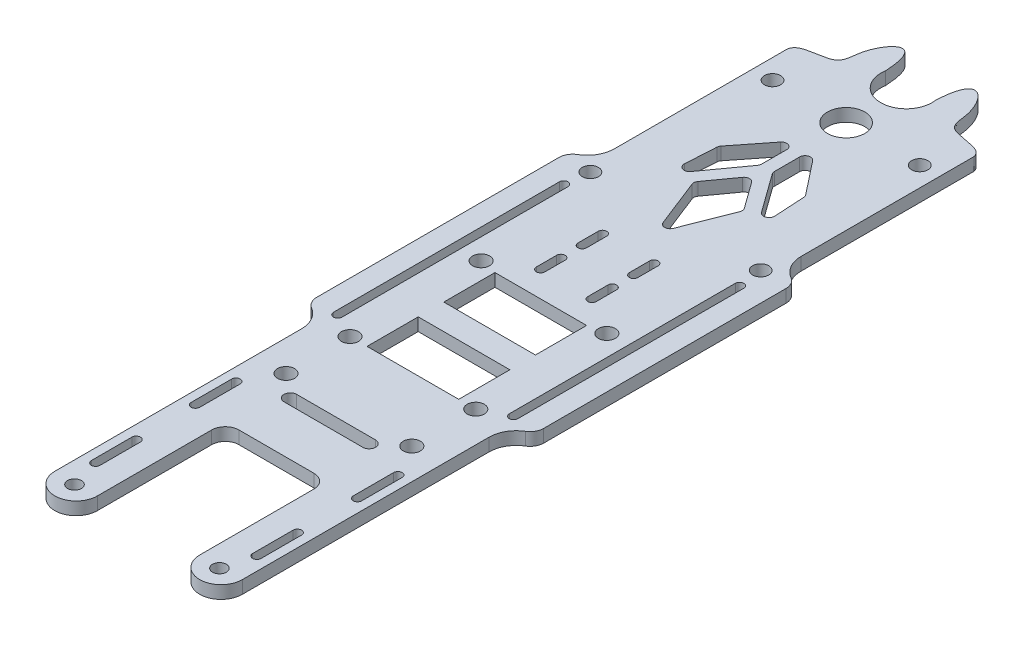
from build123d import *

# Parameters (mm, degrees)
BOSS_EXTRUDE2_START       = -1.190625
BOSS_EXTRUDE2_OUTLINE_R   = 1.28984375
BOSS_EXTRUDE2_OUTLINE_R_2 = 1.5875
BOSS_EXTRUDE2_OUTLINE_W   = 17.065625
BOSS_EXTRUDE2_OUTLINE_H   = 9.525
BOSS_EXTRUDE2_OUTLINE_R_3 = 1.503965808
BOSS_EXTRUDE2_OUTLINE_R_4 = 3.47265625
BOSS_EXTRUDE2_DEPTH       = 2.38125
FILLET1_R                 = 5.08
FILLET2_R                 = 2.54
FILLET5_R                 = 1.016
FILLET12_RADIUS           = 3.96875
FILLET12_LENGTH           = 2.38125
FILLET13_RADIUS           = 3.96875
FILLET13_LENGTH           = 2.38125


# Read off the part's stored shape, not the designer's step: Boss-Extrude2
with BuildPart() as part:
    # Boss-Extrude2 outline → Boss-Extrude2 (new body)
    with BuildSketch(Plane(origin=(0, 0, 0), x_dir=(1, 0, 0), z_dir=(0, 1, 0)).offset(BOSS_EXTRUDE2_START)):
        with BuildLine():
            add(Edge.make_bspline(
                [(35.342657076, 85.942887732), (35.813923692, 94.740411175), (40.962574381, 89.316823015), (40.695244857, 81.321998033), (47.518785772, 82.755289855), (48.014774244, 80.35917777)],
                knots=[0, 0, 0, 0, 0.509251893, 0.660798718, 1, 1, 1, 1], degree=3))
            ThreePointArc((35.342657076, 85.942887732), (30.651492993, 80.35917777), (25.960328911, 85.942887732))
            add(Edge.make_bspline(
                [(25.960328911, 85.942887732), (25.489062296, 94.740411175), (20.340411606, 89.316823015), (20.607741131, 81.321998033), (13.784200215, 82.755289855), (13.288211744, 80.35917777)],
                knots=[0, 0, 0, 0, 0.509251893, 0.660798718, 1, 1, 1, 1], degree=3))
            Line((13.288211744, 80.35917777), (13.288211744, 43.25136527))
            Line((13.288211744, 43.25136527), (9.517899244, 43.25136527))
            Line((9.517899244, 43.25136527), (9.517899244, -5.16738473))
            Line((9.517899244, -5.16738473), (13.188992994, -5.16738473))
            Line((13.188992994, -5.16738473), (13.188992994, -59.93613473))
            Line((13.188992994, -59.93613473), (21.126492994, -59.93613473))
            Line((21.126492994, -59.93613473), (21.126492994, -32.15488473))
            Line((21.126492994, -32.15488473), (40.176492994, -32.15488473))
            Line((40.176492994, -32.15488473), (40.176492994, -59.93613473))
            Line((40.176492994, -59.93613473), (48.113992994, -59.93613473))
            Line((48.113992994, -59.93613473), (48.113992994, -5.16738473))
            Line((48.113992994, -5.16738473), (51.785086744, -5.16738473))
            Line((51.785086744, -5.16738473), (51.785086744, 43.25136527))
            Line((51.785086744, 43.25136527), (48.014774244, 43.25136527))
            Line((48.014774244, 43.25136527), (48.014774244, 80.35917777))
        make_face()
        with Locations((17.157742994, -56.26504098)):
            Circle(BOSS_EXTRUDE2_OUTLINE_R, mode=Mode.SUBTRACT)
        with BuildLine():
            Line((14.854526628, -50.80800973), (14.854526628, -43.26738473))
            ThreePointArc((14.854526628, -43.26738473), (15.648276628, -42.47363473), (16.442026628, -43.26738473))
            Line((16.442026628, -43.26738473), (16.442026628, -50.80800973))
            ThreePointArc((16.442026628, -50.80800973), (15.648276628, -51.60175973), (14.854526628, -50.80800973))
        make_face(mode=Mode.SUBTRACT)
        with BuildLine():
            Line((14.776492994, -32.15488473), (14.776492994, -24.61425973))
            ThreePointArc((14.776492994, -24.61425973), (15.570242994, -23.82050973), (16.363992994, -24.61425973))
            Line((16.363992994, -24.61425973), (16.363992994, -32.15488473))
            ThreePointArc((16.363992994, -32.15488473), (15.570242994, -32.94863473), (14.776492994, -32.15488473))
        make_face(mode=Mode.SUBTRACT)
        with Locations((18.943680494, -18.66113473)):
            Circle(BOSS_EXTRUDE2_OUTLINE_R_2, mode=Mode.SUBTRACT)
        with Locations((18.943680494, -6.75488473)):
            Circle(BOSS_EXTRUDE2_OUTLINE_R_2, mode=Mode.SUBTRACT)
        with BuildLine():
            Line((15.074149244, 37.69511527), (15.074149244, -4.37363473))
            ThreePointArc((15.074149244, -4.37363473), (14.280399244, -5.16738473), (13.486649244, -4.37363473))
            Line((13.486649244, -4.37363473), (13.486649244, 37.69511527))
            ThreePointArc((13.486649244, 37.69511527), (14.280399244, 38.48886527), (15.074149244, 37.69511527))
        make_face(mode=Mode.SUBTRACT)
        with BuildLine():
            Line((23.309305494, -21.04238473), (37.993680494, -21.04238473))
            ThreePointArc((37.993680494, -21.04238473), (39.184305494, -22.23300973), (37.993680494, -23.42363473))
            Line((37.993680494, -23.42363473), (23.309305494, -23.42363473))
            ThreePointArc((23.309305494, -23.42363473), (22.118680494, -22.23300973), (23.309305494, -21.04238473))
        make_face(mode=Mode.SUBTRACT)
        with Locations((44.145242994, -56.26504098)):
            Circle(BOSS_EXTRUDE2_OUTLINE_R, mode=Mode.SUBTRACT)
        with BuildLine():
            Line((44.86095936, -50.80800973), (44.86095936, -43.26738473))
            ThreePointArc((44.86095936, -43.26738473), (45.65470936, -42.47363473), (46.44845936, -43.26738473))
            Line((46.44845936, -43.26738473), (46.44845936, -50.80800973))
            ThreePointArc((46.44845936, -50.80800973), (45.65470936, -51.60175973), (44.86095936, -50.80800973))
        make_face(mode=Mode.SUBTRACT)
        with BuildLine():
            Line((44.938992994, -32.15488473), (44.938992994, -24.61425973))
            ThreePointArc((44.938992994, -24.61425973), (45.732742994, -23.82050973), (46.526492994, -24.61425973))
            Line((46.526492994, -24.61425973), (46.526492994, -32.15488473))
            ThreePointArc((46.526492994, -32.15488473), (45.732742994, -32.94863473), (44.938992994, -32.15488473))
        make_face(mode=Mode.SUBTRACT)
        with Locations((30.651492994, -1.99238473)):
            Rectangle(BOSS_EXTRUDE2_OUTLINE_W, BOSS_EXTRUDE2_OUTLINE_H, mode=Mode.SUBTRACT)
        with Locations((30.651492994, 12.29511527)):
            Rectangle(BOSS_EXTRUDE2_OUTLINE_W, BOSS_EXTRUDE2_OUTLINE_H, mode=Mode.SUBTRACT)
        with Locations((42.359305494, -18.66113473)):
            Circle(BOSS_EXTRUDE2_OUTLINE_R_2, mode=Mode.SUBTRACT)
        with Locations((42.359305494, -6.75488473)):
            Circle(BOSS_EXTRUDE2_OUTLINE_R_2, mode=Mode.SUBTRACT)
        with BuildLine():
            Line((47.816336744, 37.69511527), (47.816336744, -4.37363473))
            ThreePointArc((47.816336744, -4.37363473), (47.022586744, -5.16738473), (46.228836744, -4.37363473))
            Line((46.228836744, -4.37363473), (46.228836744, 37.69511527))
            ThreePointArc((46.228836744, 37.69511527), (47.022586744, 38.48886527), (47.816336744, 37.69511527))
        make_face(mode=Mode.SUBTRACT)
        with Locations((18.943680494, 17.65292777)):
            Circle(BOSS_EXTRUDE2_OUTLINE_R_2, mode=Mode.SUBTRACT)
        with Locations((14.798178171, 42.145625229)):
            Circle(BOSS_EXTRUDE2_OUTLINE_R_3, mode=Mode.SUBTRACT)
        with BuildLine():
            Line((25.074149244, 21.82011527), (25.074149244, 25.590053861))
            ThreePointArc((25.074149244, 25.590053861), (25.867899244, 26.383803861), (26.661649244, 25.590053861))
            Line((26.661649244, 25.590053861), (26.661649244, 21.82011527))
            ThreePointArc((26.661649244, 21.82011527), (25.867899244, 21.02636527), (25.074149244, 21.82011527))
        make_face(mode=Mode.SUBTRACT)
        with BuildLine():
            Line((25.074149244, 29.558803861), (25.074149244, 33.328742451))
            ThreePointArc((25.074149244, 33.328742451), (25.867899244, 34.122492451), (26.661649244, 33.328742451))
            Line((26.661649244, 33.328742451), (26.661649244, 29.558803861))
            ThreePointArc((26.661649244, 29.558803861), (25.867899244, 28.765053861), (25.074149244, 29.558803861))
        make_face(mode=Mode.SUBTRACT)
        Polygon((30.651492994, 38.367133783), (26.006254314, 50.187106609), (30.651492994, 56.623383783), (35.296731673, 50.187106609), align=None, mode=Mode.SUBTRACT)
        with Locations((16.943620936, 73.90995902)):
            Circle(BOSS_EXTRUDE2_OUTLINE_R_3, mode=Mode.SUBTRACT)
        Polygon((22.028486106, 48.744587224), (22.58085534, 58.253557369), (29.460867994, 66.980130702), (29.460867994, 59.042630702), align=None, mode=Mode.SUBTRACT)
        with BuildLine():
            Line((34.641336744, 21.82011527), (34.641336744, 25.590053861))
            ThreePointArc((34.641336744, 25.590053861), (35.435086744, 26.383803861), (36.228836744, 25.590053861))
            Line((36.228836744, 25.590053861), (36.228836744, 21.82011527))
            ThreePointArc((36.228836744, 21.82011527), (35.435086744, 21.02636527), (34.641336744, 21.82011527))
        make_face(mode=Mode.SUBTRACT)
        with BuildLine():
            Line((34.641336744, 29.558803861), (34.641336744, 33.328742451))
            ThreePointArc((34.641336744, 33.328742451), (35.435086744, 34.122492451), (36.228836744, 33.328742451))
            Line((36.228836744, 33.328742451), (36.228836744, 29.558803861))
            ThreePointArc((36.228836744, 29.558803861), (35.435086744, 28.765053861), (34.641336744, 29.558803861))
        make_face(mode=Mode.SUBTRACT)
        with Locations((42.359305494, 17.65292777)):
            Circle(BOSS_EXTRUDE2_OUTLINE_R_2, mode=Mode.SUBTRACT)
        with Locations((46.504807817, 42.145625229)):
            Circle(BOSS_EXTRUDE2_OUTLINE_R_3, mode=Mode.SUBTRACT)
        Polygon((31.842117994, 59.042630702), (31.842117994, 66.980130702), (38.722130648, 58.253557369), (39.274499881, 48.744587224), align=None, mode=Mode.SUBTRACT)
        with Locations((30.651492994, 73.90995902)):
            Circle(BOSS_EXTRUDE2_OUTLINE_R_4, mode=Mode.SUBTRACT)
        with Locations((44.359365051, 73.90995902)):
            Circle(BOSS_EXTRUDE2_OUTLINE_R_3, mode=Mode.SUBTRACT)
    extrude(amount=BOSS_EXTRUDE2_DEPTH)

    # Fillet1
    # the kernel refuses this fillet: 5.08 mm, written as the material it adds along each edge
    with BuildSketch(Plane(origin=(13.288211744, -1.190625, -43.25136527), x_dir=(-1, 0, 0), z_dir=(0, 1, 0))) as fillet1_piece_1:
        with BuildLine():
            CenterArc((5.08, -4.908270434), FILLET1_R, 104.940303131, 75.059696869)
            Line((0, -4.908270434), (0, 0))
            Line((0, 0), (3.7703125, 0))
        make_face()
    fillet1_piece_1_solid = extrude(amount=2.38125, mode=Mode.PRIVATE)
    with BuildSketch(Plane(origin=(48.014774244, -1.190625, -43.25136527), x_dir=(0, 0, -1), z_dir=(0, 1, 0))) as fillet1_piece_2:
        with BuildLine():
            CenterArc((4.908270434, -5.08), FILLET1_R, 90, 75.059696869)
            Line((0, -3.7703125), (0, 0))
            Line((0, 0), (4.908270434, 0))
        make_face()
    fillet1_piece_2_solid = extrude(amount=2.38125, mode=Mode.PRIVATE)
    with BuildSketch(Plane(origin=(48.113992994, -1.190625, 5.16738473), x_dir=(1, 0, 0), z_dir=(0, 1, 0))) as fillet1_piece_3:
        with BuildLine():
            CenterArc((5.08, -4.880715437), FILLET1_R, 106.101735181, 73.898264819)
            Line((0, -4.880715437), (0, 0))
            Line((0, 0), (3.67109375, 0))
        make_face()
    fillet1_piece_3_solid = extrude(amount=2.38125, mode=Mode.PRIVATE)
    with BuildSketch(Plane(origin=(13.188992994, -1.190625, 5.16738473), x_dir=(0, 0, 1), z_dir=(0, 1, 0))) as fillet1_piece_4:
        with BuildLine():
            CenterArc((4.880715437, -5.08), FILLET1_R, 90, 73.898264819)
            Line((0, -3.67109375), (0, 0))
            Line((0, 0), (4.880715437, 0))
        make_face()
    fillet1_piece_4_solid = extrude(amount=2.38125, mode=Mode.PRIVATE)
    add([fillet1_piece_1_solid, fillet1_piece_2_solid, fillet1_piece_3_solid, fillet1_piece_4_solid])

    # Fillet2
    fillet2_edges = [part.edges().sort_by_distance(p)[0] for p in [
        (51.785086744, 0, -43.25136527),
        (51.785086744, 0, 5.16738473),
        (40.176492994, 0, 32.15488473),
        (21.126492994, 0, 32.15488473),
        (9.517899244, 0, 5.16738473),
        (9.517899244, 0, -43.25136527),
    ]]
    fillet(fillet2_edges, radius=FILLET2_R)

    # Fillet5
    fillet5_edges = [part.edges().sort_by_distance(p)[0] for p in [
        (31.842117994, 0, -66.980130702),
        (31.842117994, 0, -59.042630702),
        (39.274499881, 0, -48.744587224),
        (38.722130648, 0, -58.253557369),
        (22.028486106, 0, -48.744587224),
        (29.460867994, 0, -59.042630702),
        (29.460867994, 0, -66.980130702),
        (22.58085534, 0, -58.253557369),
        (26.006254314, 0, -50.187106609),
        (30.651492994, 0, -38.367133783),
        (35.296731673, 0, -50.187106609),
        (30.651492994, 0, -56.623383783),
    ]]
    fillet(fillet5_edges, radius=FILLET5_R)

    # Fillet12: full round fillet: the end face becomes a half cylinder, R = half its width
    fillet12_face = Plane((17.157742994, 0, 59.93613473), x_dir=(0, 1, 0), z_dir=(0, 0, 1))  # on the end face: x along it, z out of the body
    fillet12_slab = fillet12_face.offset(-FILLET12_RADIUS / 2) * Box(FILLET12_LENGTH, 2 * FILLET12_RADIUS, FILLET12_RADIUS, mode=Mode.PRIVATE)  # the body's end, R deep
    fillet12_round = Plane((17.157742994, 0, 55.96738473), x_dir=(0, 0, 1), z_dir=(0, 1, 0)) * Cylinder(FILLET12_RADIUS, FILLET12_LENGTH, mode=Mode.PRIVATE)  # its axis R under the face
    add(fillet12_slab - fillet12_round, mode=Mode.SUBTRACT)

    # Fillet13: full round fillet: the end face becomes a half cylinder, R = half its width
    fillet13_face = Plane((44.145242994, 0, 59.93613473), x_dir=(0, 1, 0), z_dir=(0, 0, 1))  # on the end face: x along it, z out of the body
    fillet13_slab = fillet13_face.offset(-FILLET13_RADIUS / 2) * Box(FILLET13_LENGTH, 2 * FILLET13_RADIUS, FILLET13_RADIUS, mode=Mode.PRIVATE)  # the body's end, R deep
    fillet13_round = Plane((44.145242994, 0, 55.96738473), x_dir=(0, 0, 1), z_dir=(0, 1, 0)) * Cylinder(FILLET13_RADIUS, FILLET13_LENGTH, mode=Mode.PRIVATE)  # its axis R under the face
    add(fillet13_slab - fillet13_round, mode=Mode.SUBTRACT)


solid = part.part
